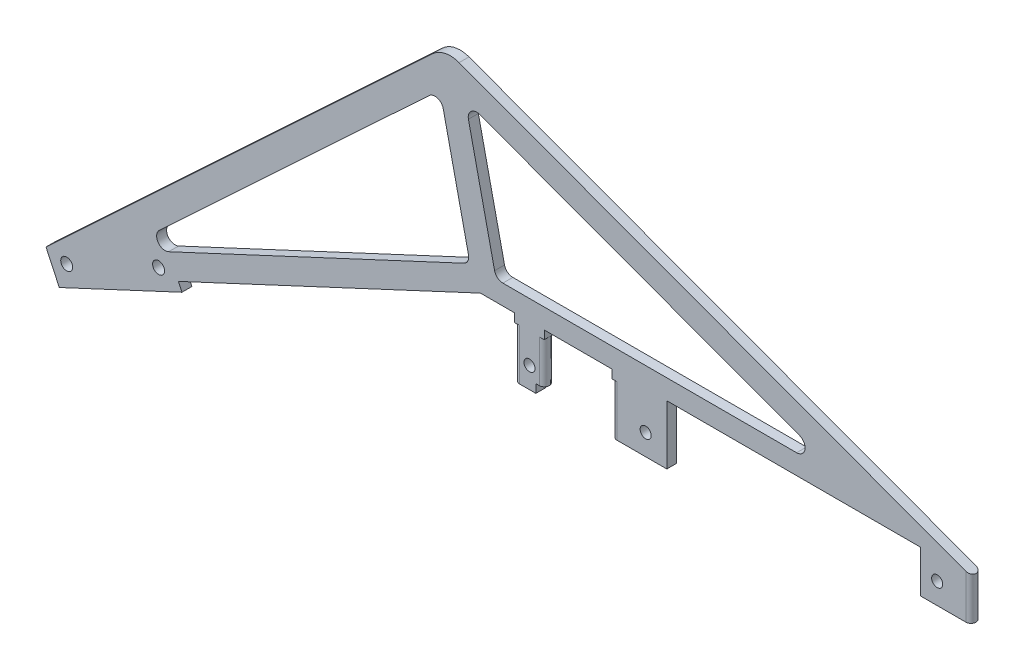
from build123d import *

# Parameters (mm, degrees)
BOSS_EXTRUDE1_DEPTH     = 3.7338
BOSS_EXTRUDE2_DEPTH     = 3.7338
CUT_EXTRUDE1_DEPTH      = 197.398400929
FILLET7_R               = 9.525
FILLET8_R               = 3.175
F_8_32_TAPPED_HOLE2_D   = 4.1656
FILLET3_RADIUS          = 1.8669
FILLET3_LENGTH          = 19.05
FILLET4_RADIUS          = 1.8669
FILLET4_LENGTH          = 19.05
FILLET5_RADIUS          = 1.8669
FILLET5_LENGTH          = 19.05
FILLET6_START           = -20
FILLET6_DEPTH           = 25
F_8_CLEARANCE_HOLE1_D   = 4.4958
CUT_EXTRUDE2_DEPTH      = 196.843388239
CUT_EXTRUDE3_DEPTH      = 196.843388239
SKETCH15_W              = 95.363977372
SKETCH15_H              = 7.9375
CUT_EXTRUDE4_DEPTH      = 196.843388239
SKETCH16_W              = 18.936022628
SKETCH16_H              = 6.35
CUT_EXTRUDE5_DEPTH      = 196.843388239
CUT_EXTRUDE6_DEPTH      = 196.843388239
CUT_EXTRUDE6_DEPTH_BACK = 196.843388239
SKETCH17_W              = 3.175
SKETCH17_H              = 3.175
SKETCH18_W              = 25.4
SKETCH18_H              = 3.175
CUT_EXTRUDE7_DEPTH      = 196.843388239


with BuildPart() as part:
    # Sketch1 → Boss-Extrude1 (new body)
    with BuildSketch(Plane.XY):
        Polygon((0, 0), (9.525, 0), (9.525, -19.05), (20.6375, -19.05), (20.6375, 0), (46.0375, 0), (46.0375, -19.05), (180.975, -19.05), (180.975, 3.175), (-16.893133293, 76.2), align=None)
    extrude(amount=BOSS_EXTRUDE1_DEPTH)

    # Sketch7 → Boss-Extrude2 (add)
    with BuildSketch(Plane.XY.offset(3.7338)):
        Polygon((-161.613635382, -74.129081959), (-0.247657199, 1.117109433), (-16.893133293, 76.2), (-166.605179671, -63.424680687), align=None)
    extrude(amount=-BOSS_EXTRUDE2_DEPTH)

    # Sketch8 → Cut-Extrude1 (cut, through all)
    with BuildSketch(Plane.XY.offset(3.7338)):
        Polygon((2.518832326, 10.642109433), (133.231722564, 10.642109433), (-9.128883742, 63.181561352), align=None)
        Polygon((-18.542737866, 61.637057548), (-138.674453357, -50.400369109), (-7.28718114, 10.86652211), align=None)
    extrude(amount=-CUT_EXTRUDE1_DEPTH, mode=Mode.SUBTRACT)

    # Fillet7
    fillet7_edges = [part.edges().sort_by_distance(p)[0] for p in [
        (-16.893133293, 76.2, 1.8669),
    ]]
    fillet(fillet7_edges, radius=FILLET7_R)

    # Fillet8
    fillet8_edges = [part.edges().sort_by_distance(p)[0] for p in [
        (-9.128883742, 63.181561352, 1.8669),
        (133.231722564, 10.642109433, 1.8669),
        (2.518832326, 10.642109433, 1.8669),
        (-7.28718114, 10.86652211, 1.8669),
        (-138.674453357, -50.400369109, 1.8669),
        (-18.542737866, 61.637057548, 1.8669),
    ]]
    fillet(fillet8_edges, radius=FILLET8_R)

    # #8-32 Tapped Hole2 (through all)
    with Locations(Plane.XY.offset(3.7338)):
        with Locations((15.08125, -11.1125), (58.7375, -11.1125), (168.275, -4.7625)):
            Hole(F_8_32_TAPPED_HOLE2_D / 2)

    # Fillet3: full round fillet: the end face becomes a half cylinder, R = half its width
    fillet3_face = Plane((9.525, -9.525, 1.8669), x_dir=(0, 1, 0), z_dir=(-1, 0, 0))  # on the end face: x along it, z out of the body
    fillet3_slab = fillet3_face.offset(-FILLET3_RADIUS / 2) * Box(FILLET3_LENGTH, 2 * FILLET3_RADIUS, FILLET3_RADIUS, mode=Mode.PRIVATE)  # the body's end, R deep
    fillet3_round = Plane((11.3919, -9.525, 1.8669), x_dir=(-1, 0, 0), z_dir=(0, 1, 0)) * Cylinder(FILLET3_RADIUS, FILLET3_LENGTH, mode=Mode.PRIVATE)  # its axis R under the face
    add(fillet3_slab - fillet3_round, mode=Mode.SUBTRACT)

    # Fillet4: full round fillet: the end face becomes a half cylinder, R = half its width
    fillet4_face = Plane((20.6375, -9.525, 1.8669), x_dir=(0, 1, 0), z_dir=(1, 0, 0))  # on the end face: x along it, z out of the body
    fillet4_slab = fillet4_face.offset(-FILLET4_RADIUS / 2) * Box(FILLET4_LENGTH, 2 * FILLET4_RADIUS, FILLET4_RADIUS, mode=Mode.PRIVATE)  # the body's end, R deep
    fillet4_round = Plane((18.7706, -9.525, 1.8669), x_dir=(1, 0, 0), z_dir=(0, 1, 0)) * Cylinder(FILLET4_RADIUS, FILLET4_LENGTH, mode=Mode.PRIVATE)  # its axis R under the face
    add(fillet4_slab - fillet4_round, mode=Mode.SUBTRACT)

    # Fillet5: full round fillet: the end face becomes a half cylinder, R = half its width
    fillet5_face = Plane((46.0375, -9.525, 1.8669), x_dir=(0, -1, 0), z_dir=(-1, 0, 0))  # on the end face: x along it, z out of the body
    fillet5_slab = fillet5_face.offset(-FILLET5_RADIUS / 2) * Box(FILLET5_LENGTH, 2 * FILLET5_RADIUS, FILLET5_RADIUS, mode=Mode.PRIVATE)  # the body's end, R deep
    fillet5_round = Plane((47.9044, -9.525, 1.8669), x_dir=(-1, 0, 0), z_dir=(0, -1, 0)) * Cylinder(FILLET5_RADIUS, FILLET5_LENGTH, mode=Mode.PRIVATE)  # its axis R under the face
    add(fillet5_slab - fillet5_round, mode=Mode.SUBTRACT)

    # Fillet6: read off the stored shape, not the designer's step
    # Fillet6 outline → Fillet6 (cut)
    with BuildSketch(Plane(origin=(0, 0, 0), x_dir=(1, 0, 0), z_dir=(0, 1, 0)).offset(FILLET6_START)):
        with BuildLine():
            ThreePointArc((179.1081, 0), (180.42819765, -0.54680235), (180.975, -1.8669))
            Line((180.975, -1.8669), (180.975, 0))
            Line((180.975, 0), (179.1081, 0))
        make_face()
        with BuildLine():
            ThreePointArc((180.975, -1.8669), (180.42819765, -3.18699765), (179.1081, -3.7338))
            Line((179.1081, -3.7338), (180.975, -3.7338))
            Line((180.975, -3.7338), (180.975, -1.8669))
        make_face()
    extrude(amount=FILLET6_DEPTH, mode=Mode.SUBTRACT)

    # #8 Clearance Hole1 (through all)
    with Locations(Plane.XY.offset(3.7338)):
        with Locations((-158.829891599, -65.073459713), (-124.299564913, -48.97170394)):
            Hole(F_8_CLEARANCE_HOLE1_D / 2)

    # Sketch12 → Cut-Extrude2 (cut, through all)
    with BuildSketch(Plane.XY.offset(3.7338)):
        Polygon((-0.247657199, 1.117109433), (0, 1.232593882), (0, 0), align=None)
    extrude(amount=-CUT_EXTRUDE2_DEPTH, mode=Mode.SUBTRACT)

    # Sketch14 → Cut-Extrude3 (cut, through all)
    with BuildSketch(Plane.XY.offset(3.7338)):
        with BuildLine():
            Line((71.4375, -6.35), (157.276477372, -6.35))
            ThreePointArc((157.276477372, -6.35), (162.038977372, -11.1125), (157.276477372, -15.875))
            Line((157.276477372, -15.875), (71.4375, -15.875))
            ThreePointArc((71.4375, -15.875), (66.675, -11.1125), (71.4375, -6.35))
        make_face()
    extrude(amount=-CUT_EXTRUDE3_DEPTH, mode=Mode.SUBTRACT)

    # Sketch15 → Cut-Extrude4 (cut, through all)
    with BuildSketch(Plane.XY.offset(3.7338)):
        with Locations((114.356988686, -15.08125)):
            Rectangle(SKETCH15_W, SKETCH15_H)
    extrude(amount=-CUT_EXTRUDE4_DEPTH, mode=Mode.SUBTRACT)

    # Sketch16 → Cut-Extrude5 (cut, through all)
    with BuildSketch(Plane.XY.offset(3.7338)):
        with Locations((171.506988686, -15.875)):
            Rectangle(SKETCH16_W, SKETCH16_H)
    extrude(amount=-CUT_EXTRUDE5_DEPTH, mode=Mode.SUBTRACT)

    # Sketch17 → Cut-Extrude6 (cut, two sides: drawn at the far end of the back side and taken through both)
    with BuildSketch(Plane.XY.offset(3.7338).offset(-CUT_EXTRUDE6_DEPTH_BACK)):
        with Locations((19.05, -17.4625)):
            Rectangle(SKETCH17_W, SKETCH17_H)
    extrude(amount=CUT_EXTRUDE6_DEPTH + CUT_EXTRUDE6_DEPTH_BACK, mode=Mode.SUBTRACT)

    # Sketch18 → Cut-Extrude7 (cut, through all)
    with BuildSketch(Plane.XY.offset(3.7338)):
        Polygon((-3.347186663, 3.175), (-2.005373682, 0.297472776), (0, 1.232593882), (0, 0), (9.525, 0), (9.525, 3.175), align=None)
        Polygon((-116.86007736, -49.756930231), (-115.518264379, -52.634457455), (-2.005373682, 0.297472776), (-3.347186663, 3.175), align=None)
        with Locations((33.3375, 1.5875)):
            Rectangle(SKETCH18_W, SKETCH18_H)
        with BuildLine():
            ThreePointArc((157.276477372, -6.35), (160.644073417, -7.744903955), (162.038977372, -11.1125))
            Line((162.038977372, -11.1125), (162.038977372, 3.175))
            Line((162.038977372, 3.175), (66.675, 3.175))
            Line((66.675, 3.175), (66.675, -11.1125))
            ThreePointArc((66.675, -11.1125), (68.069903955, -7.744903955), (71.4375, -6.35))
            Line((71.4375, -6.35), (157.276477372, -6.35))
        make_face()
    extrude(amount=-CUT_EXTRUDE7_DEPTH, mode=Mode.SUBTRACT)


solid = part.part
